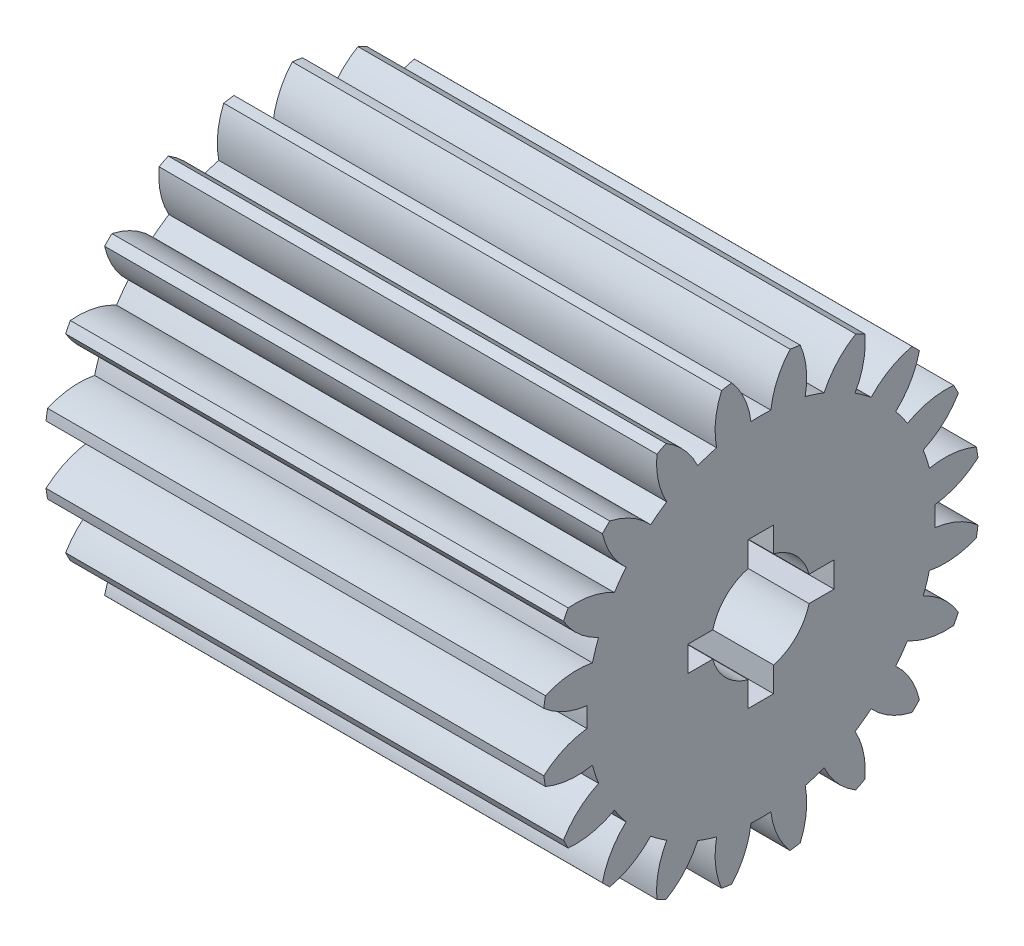
from build123d import *

# Parameters (mm, degrees)
BASPROSKE_W        = 10
BASPROSKE_H        = 4.4
TOOTHCUT_DEPTH     = 12.777945491
TEETHCUTS_COUNT    = 20
TEETHCUTS_ANGLE    = 342
BORSKE_R           = 1
BORE_DEPTH         = 50.0000508
SKETCH1_W          = 0.51
SKETCH1_H          = 0.51
CUT_EXTRUDE1_DEPTH = 100


with BuildPart() as part:
    # BasProSke → Base-Revolve (revolve)
    with BuildSketch(Plane(origin=(0, 0, 0), x_dir=(1, 0, 0), z_dir=(0, 1, 0))):
        with Locations((5, 2.2)):
            Rectangle(BASPROSKE_W, BASPROSKE_H)
    revolve(axis=Axis((-10, 0, 0), (1, 0, 0)))

    # TooCutSke → ToothCut (cut, through all)
    with BuildSketch(Plane(origin=(0, 0, 0), x_dir=(0, 0, -1), z_dir=(1, 0, 0))):
        with BuildLine():
            ThreePointArc((0.199592598, 3.493302706), (0, 3.499), (-0.199592598, 3.493302706))
            ThreePointArc((-0.199592598, 3.493302706), (-0.333052166, 3.970347354), (-0.606028648, 4.383707841))
            ThreePointArc((-0.606028648, 4.383707841), (0, 4.4254), (0.606028648, 4.383707841))
            ThreePointArc((0.606028648, 4.383707841), (0.333052166, 3.970347354), (0.199592598, 3.493302706))
        make_face()
    toothcut = extrude(amount=TOOTHCUT_DEPTH, mode=Mode.SUBTRACT)

    # TeethCuts: ToothCut ×20 about axis
    teethcuts_axis = Axis((-10, 0, 0), (1, 0, 0))
    for i in range(1, TEETHCUTS_COUNT):
        add(toothcut.rotate(teethcuts_axis, i * TEETHCUTS_ANGLE / (TEETHCUTS_COUNT - 1)), mode=Mode.SUBTRACT)

    # BorSke → Bore (cut, symmetric)
    with BuildSketch(Plane(origin=(0, 0, 0), x_dir=(0, 0, -1), z_dir=(1, 0, 0))):
        Circle(BORSKE_R)
    extrude(amount=BORE_DEPTH, both=True, mode=Mode.SUBTRACT)

    # Sketch1 → Cut-Extrude1 (cut)
    with BuildSketch(Plane(origin=(10, 0, 0), x_dir=(0, 0, -1), z_dir=(1, 0, 0))):
        with Locations((0, 1.213665218)):
            Rectangle(SKETCH1_W, SKETCH1_H)
        with Locations((1.213665218, 0)):
            Rectangle(SKETCH1_W, SKETCH1_H)
        with Locations((0, -1.213665218)):
            Rectangle(SKETCH1_W, SKETCH1_H)
        with Locations((-1.213665218, 0)):
            Rectangle(SKETCH1_W, SKETCH1_H)
    extrude(amount=-CUT_EXTRUDE1_DEPTH, mode=Mode.SUBTRACT)


solid = part.part
